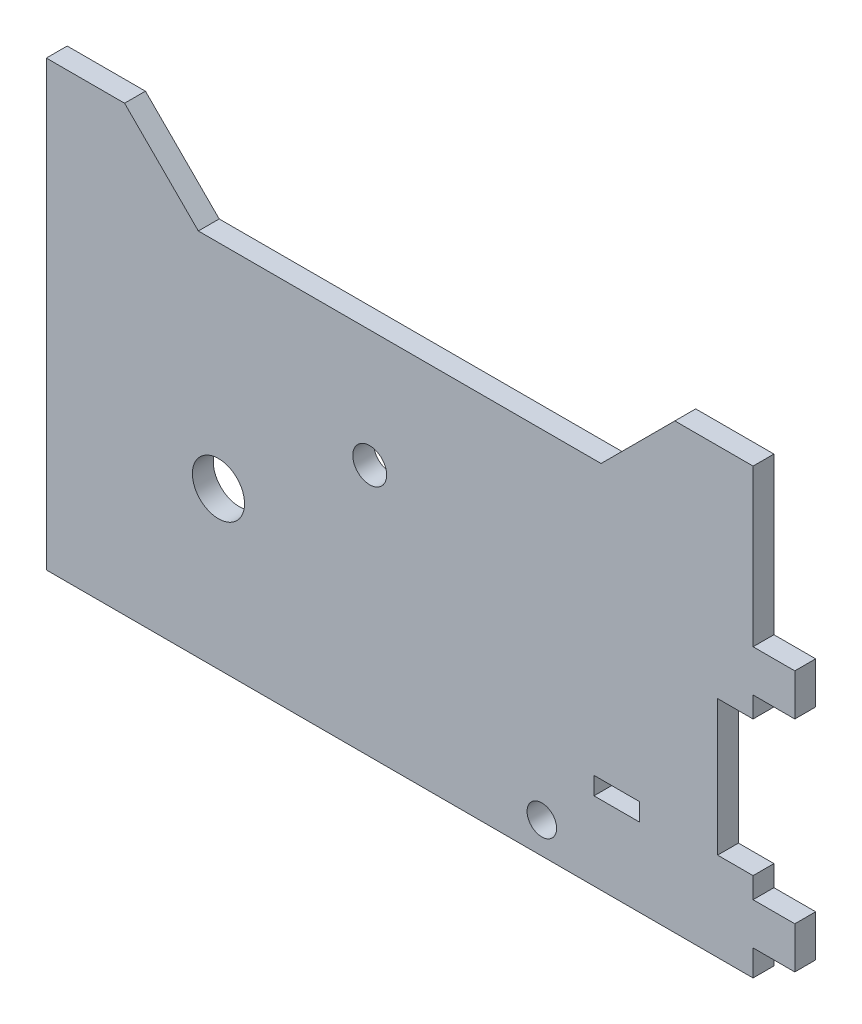
from build123d import *

# Parameters (mm, degrees)
SKETCH1_R           = 5
SKETCH1_R_2         = 2.83
SKETCH1_R_3         = 3.25
SKETCH1_W           = 8.7
SKETCH1_H           = 3.4
BOSS_EXTRUDE1_DEPTH = 4
BOSS_EXTRUDE2_DEPTH = 4


with BuildPart() as part:
    # Sketch1 → Boss-Extrude1 (new body)
    with BuildSketch(Plane.XY):
        Polygon((49, 30), (56.5, 30), (56.5, 25), (64.5, 25), (64.5, 17), (56.5, 17), (56.5, 13), (49.7, 13), (49.7, -13), (56.5, -13), (56.5, -17), (64.5, -17), (64.5, -25), (56.5, -25), (56.5, -30), (49, -30), (-79, -30), (-79, 30), align=None)
        with Locations((-46, 0)):
            Circle(SKETCH1_R, mode=Mode.SUBTRACT)
        with Locations((16, -24)):
            Circle(SKETCH1_R_2, mode=Mode.SUBTRACT)
        with Locations((-17, 18.39610675)):
            Circle(SKETCH1_R_3, mode=Mode.SUBTRACT)
        with Locations((30.35, -13.3)):
            Rectangle(SKETCH1_W, SKETCH1_H, mode=Mode.SUBTRACT)
    extrude(amount=BOSS_EXTRUDE1_DEPTH)

    # Sketch2 → Boss-Extrude2 (add)
    with BuildSketch(Plane.XY):
        Polygon((-79, 30), (56.5, 30), (56.5, 55), (41.5, 55), (27.357864376, 40.857864376), (-49.857864376, 40.857864376), (-64, 55), (-79, 55), align=None)
    extrude(amount=BOSS_EXTRUDE2_DEPTH)


solid = part.part
